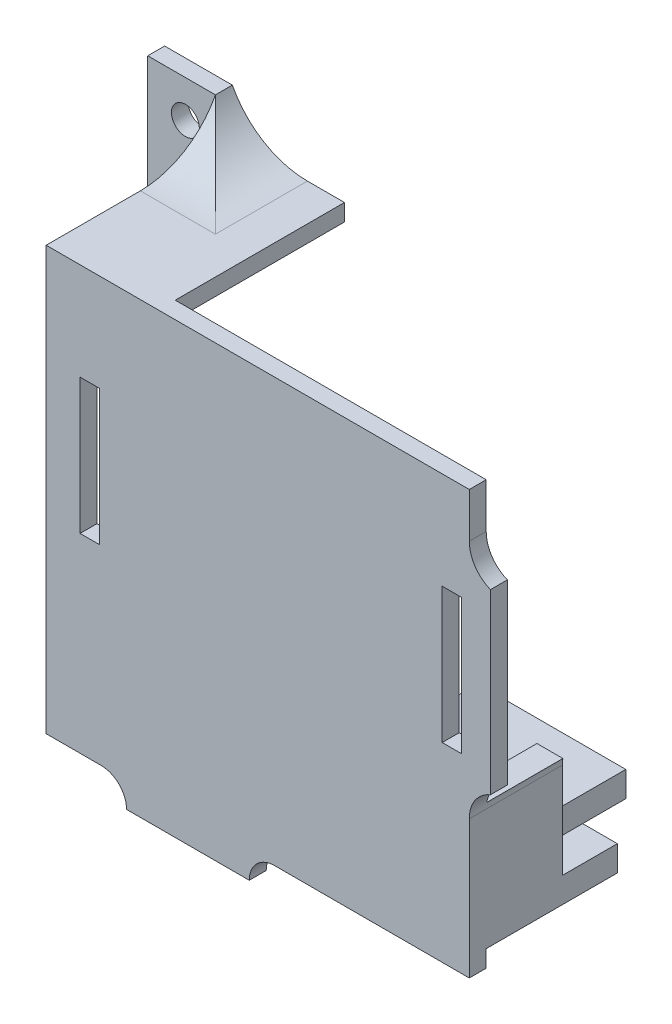
from build123d import *

# Parameters (mm, degrees)
SKETCH1_W               = 50
SKETCH1_H               = 50
BOSS_EXTRUDE1_DEPTH     = 2
CUT_EXTRUDE1_DEPTH      = 36.411862419
CUT_EXTRUDE1_DEPTH_BACK = 36.411862419
SKETCH2_W               = 2.3
SKETCH2_H               = 16
SKETCH3_W               = 22
SKETCH3_H               = 3
SKETCH3_W_2             = 5
BOSS_EXTRUDE2_DEPTH     = 14.5
SKETCH4_W               = 5
SKETCH4_H               = 2
SKETCH4_W_2             = 4
BOSS_EXTRUDE11_DEPTH    = 13
SKETCH5_W               = 3.5
SKETCH5_H               = 3
SKETCH5_W_2             = 18
BOSS_EXTRUDE12_DEPTH    = 1
SKETCH6_W               = 3.5
SKETCH6_H               = 12
SKETCH6_W_2             = 3
BOSS_EXTRUDE13_DEPTH    = 9
SKETCH7_W               = 3.5
SKETCH7_H               = 8
BOSS_EXTRUDE14_DEPTH    = 11
SKETCH8_W               = 2
SKETCH8_H               = 8
BOSS_EXTRUDE15_DEPTH    = 8
BOSS_EXTRUDE16_DEPTH    = 20
SKETCH10_W              = 2
SKETCH10_H              = 15
BOSS_EXTRUDE17_DEPTH    = 8
FILLET1_R               = 10
FILLET2_START           = -18
FILLET2_DEPTH           = 0.13972
FILLET2_START_2         = -17.86028
FILLET2_2_DEPTH         = 8.733515347
FILLET2_START_3         = -25
FILLET2_3_DEPTH         = 8.873235347
CUT_EXTRUDE2_DEPTH      = 50.964612469
CUT_EXTRUDE2_DEPTH_BACK = 50.964612469
SKETCH11_R              = 1.65
SKETCH13_W              = 2.5
SKETCH13_H              = 21
BOSS_EXTRUDE18_DEPTH    = 2
FILLET3_R               = 4
SKETCH14_W              = 17.5
SKETCH14_H              = 3
BOSS_EXTRUDE19_DEPTH    = 19.5
FILLET4_R               = 3
SKETCH15_W              = 14.5
SKETCH15_H              = 2
BOSS_EXTRUDE20_DEPTH    = 3
FILLET5_R               = 3
FILLET6_R               = 3


with BuildPart() as part:
    # Sketch1 → Boss-Extrude1 (new body)
    with BuildSketch(Plane.XY):
        Rectangle(SKETCH1_W, SKETCH1_H)
    extrude(amount=BOSS_EXTRUDE1_DEPTH)

    # Sketch2 → Cut-Extrude1 (cut, two sides: drawn at the far end of the back side and taken through both)
    with BuildSketch(Plane.XY.offset(2).offset(-CUT_EXTRUDE1_DEPTH_BACK)):
        with Locations((-19.85, 5.5)):
            Rectangle(SKETCH2_W, SKETCH2_H)
        with Locations((22.95, 5.5)):
            Rectangle(SKETCH2_W, SKETCH2_H)
    extrude(amount=CUT_EXTRUDE1_DEPTH + CUT_EXTRUDE1_DEPTH_BACK, mode=Mode.SUBTRACT)

    # Sketch3 → Boss-Extrude2 (add)
    with BuildSketch(Plane(origin=(0, 0, 0), x_dir=(-1, 0, 0), z_dir=(0, 0, -1))):
        with Locations((-14, -21.5)):
            Rectangle(SKETCH3_W, SKETCH3_H)
        with Locations((22.5, -21.5)):
            Rectangle(SKETCH3_W_2, SKETCH3_H)
    extrude(amount=BOSS_EXTRUDE2_DEPTH)

    # Sketch4 → Boss-Extrude11 (add)
    with BuildSketch(Plane(origin=(0, 0, 0), x_dir=(-1, 0, 0), z_dir=(0, 0, -1))):
        with Locations((3.5, -24)):
            Rectangle(SKETCH4_W, SKETCH4_H)
        with Locations((13.5, -24)):
            Rectangle(SKETCH4_W_2, SKETCH4_H)
    extrude(amount=BOSS_EXTRUDE11_DEPTH)

    # Sketch5 → Boss-Extrude12 (add)
    with BuildSketch(Plane(origin=(0, 0, -14.5), x_dir=(-1, 0, 0), z_dir=(0, 0, -1))):
        with Locations((23.25, -21.5)):
            Rectangle(SKETCH5_W, SKETCH5_H)
        with Locations((-16, -21.5)):
            Rectangle(SKETCH5_W_2, SKETCH5_H)
    extrude(amount=BOSS_EXTRUDE12_DEPTH)

    # Sketch6 → Boss-Extrude13 (add)
    with BuildSketch(Plane(origin=(0, 0, 0), x_dir=(-1, 0, 0), z_dir=(0, 0, -1))):
        with Locations((23.25, -14)):
            Rectangle(SKETCH6_W, SKETCH6_H)
        with Locations((-23.5, -14)):
            Rectangle(SKETCH6_W_2, SKETCH6_H)
    extrude(amount=BOSS_EXTRUDE13_DEPTH)

    # Sketch7 → Boss-Extrude14 (add)
    with BuildSketch(Plane(origin=(0, 0, -9), x_dir=(-1, 0, 0), z_dir=(0, 0, -1))):
        with Locations((23.25, -14)):
            Rectangle(SKETCH7_W, SKETCH7_H)
    extrude(amount=BOSS_EXTRUDE14_DEPTH)

    # Sketch8 → Boss-Extrude15 (add)
    with BuildSketch(Plane.ZY.offset(25)):
        with Locations((-19, -14)):
            Rectangle(SKETCH8_W, SKETCH8_H)
    extrude(amount=BOSS_EXTRUDE15_DEPTH)

    # Sketch9 → Boss-Extrude16 (add)
    with BuildSketch(Plane(origin=(0, 0, 0), x_dir=(-1, 0, 0), z_dir=(0, 0, -1))):
        Polygon((11.748068925, 25), (11.748068925, 23), (23, 23), (23, 15.388525781), (25, 15.388525781), (25, 25), align=None)
    extrude(amount=BOSS_EXTRUDE16_DEPTH)

    # Sketch10 → Boss-Extrude17 (add)
    with BuildSketch(Plane.ZY.offset(25)):
        with Locations((-19, 22.888525781)):
            Rectangle(SKETCH10_W, SKETCH10_H)
    extrude(amount=BOSS_EXTRUDE17_DEPTH)

    # Fillet1
    # the kernel refuses this fillet: 10 mm, written as the material it adds along each edge
    with BuildSketch(Plane(origin=(-25, 25, -20), x_dir=(1, 0, 0), z_dir=(0, 0, 1))) as fillet1_piece_1:
        with BuildLine():
            CenterArc((8.873235347, 10), FILLET1_R, 207.461173358, 62.538826642)
            Line((0, 5.388525781), (0, 0))
            Line((0, 0), (8.873235347, 0))
        make_face()
    extrude(amount=2)

    # Fillet2: read off the stored shape, not the designer's step
    # Fillet2 outline → Fillet2 (add)
    with BuildSketch(Plane.XY.offset(FILLET2_START)):
        with BuildLine():
            Line((-25, 30.388525781), (-25, 25))
            Line((-25, 25), (-16.126764653, 25))
            ThreePointArc((-16.126764653, 25), (-21.317393604, 26.452639525), (-25, 30.388525781))
        make_face()
    extrude(amount=FILLET2_DEPTH)

    # Fillet2 2 outline → Fillet2 2 (add)
    with BuildSketch(Plane.XY.offset(FILLET2_START_2)):
        with BuildLine():
            Line((-25, 30.388525781), (-25, 25))
            Line((-25, 25), (-16.126764653, 25))
            ThreePointArc((-16.126764653, 25), (-21.317393604, 26.452639525), (-25, 30.388525781))
        make_face()
    extrude(amount=FILLET2_2_DEPTH)

    # Fillet2 3 outline → Fillet2 3 (cut)
    with BuildSketch(Plane.YZ.offset(FILLET2_START_3)):
        with BuildLine():
            ThreePointArc((25, -9.126764653), (26.452639525, -14.317393604), (30.388525781, -18))
            Line((30.388525781, -18), (32, -18.837492924))
            Line((32, -18.837492924), (32, -9.126764653))
            Line((32, -9.126764653), (25, -9.126764653))
        make_face()
    extrude(amount=FILLET2_3_DEPTH, mode=Mode.SUBTRACT)

    # Sketch11 → Cut-Extrude2 (cut, two sides: drawn at the far end of the back side and taken through both)
    with BuildSketch(Plane(origin=(0, 0, -20), x_dir=(-1, 0, 0), z_dir=(0, 0, -1)).offset(-CUT_EXTRUDE2_DEPTH_BACK)):
        with Locations((28.55, 26)):
            Circle(SKETCH11_R)
        with Locations((28.55, -14)):
            Circle(SKETCH11_R)
    extrude(amount=CUT_EXTRUDE2_DEPTH + CUT_EXTRUDE2_DEPTH_BACK, mode=Mode.SUBTRACT)

    # Sketch13 → Boss-Extrude18 (add)
    with BuildSketch(Plane(origin=(0, 0, 0), x_dir=(-1, 0, 0), z_dir=(0, 0, -1))):
        with Locations((-26.25, 5.5)):
            Rectangle(SKETCH13_W, SKETCH13_H)
    extrude(amount=-BOSS_EXTRUDE18_DEPTH)

    # Fillet3
    # the kernel refuses this fillet: 4 mm, written as the material it adds along each edge
    with BuildSketch(Plane(origin=(25, -5, -9.270248109), x_dir=(0, -1, 0), z_dir=(0, 0, 1))) as fillet3_piece_1_section:
        with BuildLine():
            CenterArc((3.708099244, 4), FILLET3_R, 202.024312837, 67.975687163)
            Line((0, 2.5), (-0.074161985, 2.47))
            ThreePointArc((-0.074161985, 2.47), (-0.08, 1.25), (-0.08, 0))
            Line((-0.08, 0), (0, -0.08))
            Line((0, -0.08), (3.708099244, -0.08))
            Line((3.708099244, -0.08), (3.708099244, 0))
        make_face()
    fillet3_piece_1 = extrude(amount=11.270248109, mode=Mode.PRIVATE)
    fillet3_piece_1 = split(fillet3_piece_1, bisect_by=Plane(origin=(25, -5, 0), z_dir=(0, 0, -1)), keep=Keep.TOP, mode=Mode.PRIVATE)
    fillet3_piece_1 = split(fillet3_piece_1, bisect_by=Plane(origin=(25, -8, -9.270248109), z_dir=(0, -1, 0)), keep=Keep.TOP, mode=Mode.PRIVATE)
    fillet3_piece_1 = split(fillet3_piece_1, bisect_by=Plane(origin=(25, -5, -9), z_dir=(0, 0, 1)), keep=Keep.TOP, mode=Mode.PRIVATE)
    add(fillet3_piece_1)
    with BuildSketch(Plane(origin=(25, -5, 0), x_dir=(0, -1, 0), z_dir=(0, 0, 1))) as fillet3_piece_2_section:
        with BuildLine():
            CenterArc((3.708099244, 4), FILLET3_R, 202.024312837, 67.975687163)
            Line((0, 2.5), (-0.074161985, 2.47))
            ThreePointArc((-0.074161985, 2.47), (-0.08, 1.25), (-0.08, 0))
            Line((-0.08, 0), (0, -0.08))
            Line((0, -0.08), (3.708099244, -0.08))
            Line((3.708099244, -0.08), (3.708099244, 0))
        make_face()
    fillet3_piece_2 = extrude(amount=2, mode=Mode.PRIVATE)
    fillet3_piece_2 = split(fillet3_piece_2, bisect_by=Plane(origin=(25, -8, 0), z_dir=(0, -1, 0)), keep=Keep.TOP, mode=Mode.PRIVATE)
    add(fillet3_piece_2)
    with BuildSketch(Plane(origin=(25, -5, 0), x_dir=(0, -1, 0), z_dir=(0, 0, 1))) as fillet3_piece_3_section:
        with BuildLine():
            CenterArc((3.708099244, 4), FILLET3_R, 202.024312837, 67.975687163)
            Line((0, 2.5), (-0.074161985, 2.47))
            ThreePointArc((-0.074161985, 2.47), (-0.08, 1.25), (-0.08, 0))
            Line((-0.08, 0), (0, -0.08))
            Line((0, -0.08), (3.708099244, -0.08))
            Line((3.708099244, -0.08), (3.708099244, 0))
        make_face()
    fillet3_piece_3 = extrude(amount=2, mode=Mode.PRIVATE)
    fillet3_piece_3 = split(fillet3_piece_3, bisect_by=Plane(origin=(25, -8, 0), z_dir=(0, 1, 0)), keep=Keep.TOP, mode=Mode.PRIVATE)
    add(fillet3_piece_3)
    with BuildSketch(Plane(origin=(25, 16, 0), x_dir=(0, 1, 0), z_dir=(0, 0, 1))) as fillet3_piece_4:
        with BuildLine():
            CenterArc((3.708099244, -4), FILLET3_R, 90, 67.975687163)
            Line((0, -2.5), (-0.074161985, -2.47))
            ThreePointArc((-0.074161985, -2.47), (-0.08, -1.25), (-0.08, 0))
            Line((-0.08, 0), (0, 0.08))
            Line((0, 0.08), (3.708099244, 0.08))
            Line((3.708099244, 0.08), (3.708099244, 0))
        make_face()
    extrude(amount=2)

    # Sketch14 → Boss-Extrude19 (add)
    with BuildSketch(Plane(origin=(0, 0, 0), x_dir=(-1, 0, 0), z_dir=(0, 0, -1))):
        with Locations((-13.25, -17.4)):
            Rectangle(SKETCH14_W, SKETCH14_H)
    extrude(amount=BOSS_EXTRUDE19_DEPTH)

    # Fillet4
    fillet4_edges = [part.edges().sort_by_distance(p)[0] for p in [
        (-3.5, -23, 0),
        (-13.5, -23, 0),
    ]]
    fillet(fillet4_edges, radius=FILLET4_R)

    # Sketch15 → Boss-Extrude20 (add)
    with BuildSketch(Plane.XZ.offset(25)):
        with Locations((-8.25, 1)):
            Rectangle(SKETCH15_W, SKETCH15_H)
    extrude(amount=BOSS_EXTRUDE20_DEPTH)

    # Fillet5
    # the kernel refuses this fillet: 3 mm, written as the material it adds along each edge
    with BuildSketch(Plane(origin=(-15.5, -25, 2), x_dir=(-1, 0, 0), z_dir=(0, 0, -1)), Plane(origin=(-1, -25, 0), x_dir=(1, 0, 0), z_dir=(0, 0, 1))) as fillet5_piece_1:
        with BuildLine():
            CenterArc((FILLET5_R, -FILLET5_R), FILLET5_R, 90, 90)
            Line((0, -FILLET5_R), (0, 0))
            Line((0, 0), (FILLET5_R, 0))
        make_face()
    extrude(amount=2)

    # Fillet6
    fillet6_edges = [part.edges().sort_by_distance(p)[0] for p in [
        (-3.5, -25, 0),
        (-13.5, -25, 0),
    ]]
    fillet(fillet6_edges, radius=FILLET6_R - 0.0001)  # a hair under: the kernel refuses the full size


solid = part.part
